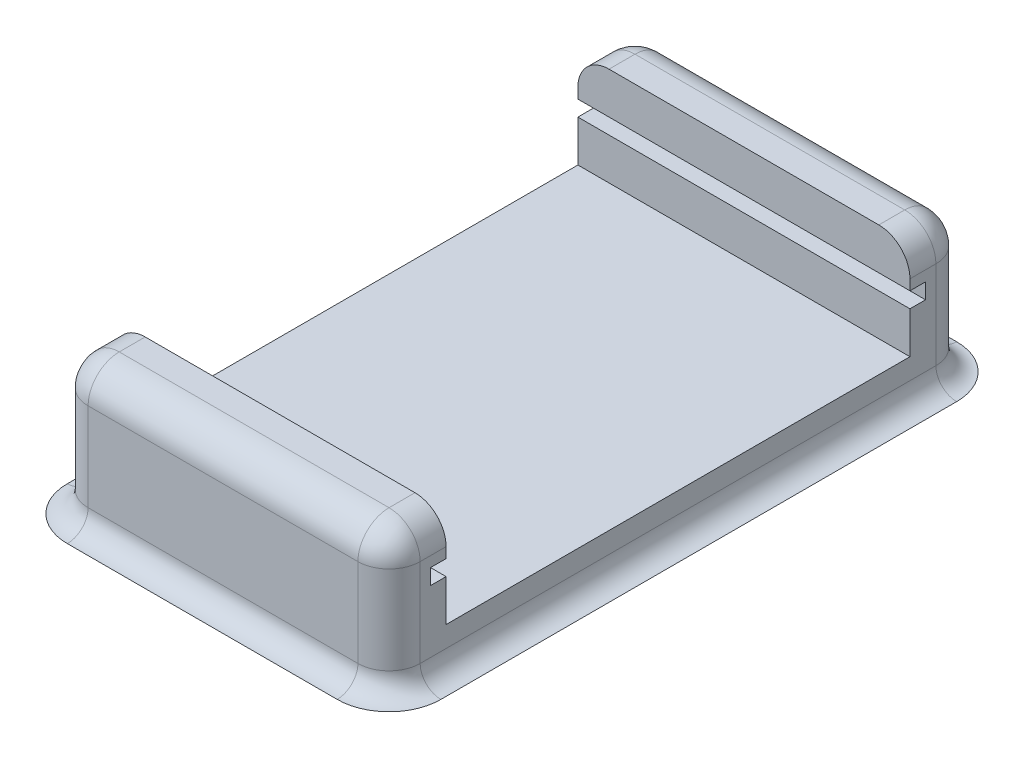
from build123d import *

# Parameters (mm, degrees)
SKETCH2_W               = 88.9
SKETCH2_H               = 152.4
BOSS_EXTRUDE1_DEPTH     = 5.9944
CUT_EXTRUDE2_DEPTH      = 177.535840076
CUT_EXTRUDE2_DEPTH_BACK = 177.535840076
SKETCH4_R               = 2.7305
BOSS_EXTRUDE2_DEPTH     = 101.6
FILLET1_R               = 3.81
FILLET2_R               = 2.54
BOSS_EXTRUDE3_DEPTH     = 20.32
FILLET3_R               = 3.81
FILLET6_R               = 3.81
FILLET7_R               = 2.54
CUT_EXTRUDE3_DEPTH      = 204.596488182
CUT_EXTRUDE3_DEPTH_BACK = 204.596488182
SKETCH7_W               = 2.54
SKETCH7_H               = 152.4
SKETCH8_W               = 86.36
SKETCH8_H               = 152.4
CUT_EXTRUDE4_DEPTH      = 5.9944
SKETCH9_R               = 0.79375
CUT_EXTRUDE5_DEPTH      = 3.175


with BuildPart() as part:
    # Sketch2 → Boss-Extrude1 (new body)
    with BuildSketch(Plane(origin=(0, 0, 0), x_dir=(1, 0, 0), z_dir=(0, 1, 0))):
        with Locations((44.45, 76.2)):
            Rectangle(SKETCH2_W, SKETCH2_H)
    extrude(amount=BOSS_EXTRUDE1_DEPTH)

    # Sketch4 → Cut-Extrude2 (cut, two sides: drawn at the far end of the back side and taken through both)
    with BuildSketch(Plane(origin=(0, 5.9944, 0), x_dir=(1, 0, 0), z_dir=(0, 1, 0)).offset(-CUT_EXTRUDE2_DEPTH_BACK)):
        with Locations(Location((45.72, 109.871331367, 0), (0, 0, 270))):
            Circle(SKETCH4_R)
        with Locations(Location((45.72, 33.671331367, 0), (0, 0, 270))):
            Circle(SKETCH4_R)
    extrude(amount=CUT_EXTRUDE2_DEPTH + CUT_EXTRUDE2_DEPTH_BACK, mode=Mode.SUBTRACT)

    # Sketch5 → Boss-Extrude2 (add)
    with BuildSketch(Plane(origin=(0, 5.9944, 0), x_dir=(1, 0, 0), z_dir=(0, 1, 0))):
        Polygon((18.542, 15.748), (12.446, 15.748), (12.446, 2.54), (76.454, 2.54), (76.454, 15.748), (70.358, 15.748), (70.358, 13.208), (71.374, 13.208), (71.374, 11.43), (70.358, 11.43), (70.358, 7.62), (18.542, 7.62), (18.542, 11.43), (17.526, 11.43), (17.526, 13.208), (18.542, 13.208), align=None)
    extrude(amount=BOSS_EXTRUDE2_DEPTH)

    # Fillet1
    fillet1_edges = [part.edges().sort_by_distance(p)[0] for p in [
        (12.446, 56.7944, -15.748),
        (12.446, 56.7944, -2.54),
        (76.454, 56.7944, -2.54),
        (76.454, 56.7944, -15.748),
    ]]
    fillet(fillet1_edges, radius=FILLET1_R)

    # Fillet2
    fillet2_edges = [part.edges().sort_by_distance(p)[0] for p in [
        (71.501, 5.9944, -15.748),
        (44.45, 5.9944, -2.54),
        (12.446, 5.9944, -9.144),
        (17.399, 5.9944, -15.748),
        (76.454, 5.9944, -9.144),
        (13.561923164, 5.9944, -3.655923164),
        (13.561923164, 5.9944, -14.632076836),
        (75.338076836, 5.9944, -3.655923164),
        (75.338076836, 5.9944, -14.632076836),
    ]]
    fillet(fillet2_edges, radius=FILLET2_R - 0.0001)  # a hair under: the kernel refuses the full size

    # Sketch6 → Boss-Extrude3 (add, symmetric)
    with BuildSketch(Plane.ZY.offset(-44.45)):
        Polygon((-149.86, 5.9944), (-79.121, 5.9944), (-79.121, 23.1394), (-86.106, 23.1394), (-86.106, 18.0594), (-84.201, 18.0594), (-84.201, 16.1544), (-86.106, 16.1544), (-86.106, 11.0744), (-142.875, 11.0744), (-142.875, 16.1544), (-144.78, 16.1544), (-144.78, 18.0594), (-142.875, 18.0594), (-142.875, 23.1394), (-149.86, 23.1394), align=None)
    extrude(amount=BOSS_EXTRUDE3_DEPTH, both=True)

    # Fillet3
    fillet3_edges = [part.edges().sort_by_distance(p)[0] for p in [
        (44.45, 23.1394, -149.86),
        (44.45, 23.1394, -79.121),
    ]]
    fillet(fillet3_edges, radius=FILLET3_R)

    # Fillet6
    fillet6_edges = [part.edges().sort_by_distance(p)[0] for p in [
        (24.13, 12.6619, -149.86),
        (64.77, 12.6619, -79.121),
        (24.13, 23.1394, -84.5185),
        (24.13, 12.6619, -79.121),
        (64.77, 23.1394, -84.5185),
        (64.77, 12.6619, -149.86),
        (64.77, 23.1394, -144.4625),
        (64.77, 22.023476836, -148.744076836),
        (64.77, 22.023476836, -80.236923164),
        (24.13, 23.1394, -144.4625),
        (24.13, 22.023476836, -148.744076836),
        (24.13, 22.023476836, -80.236923164),
    ]]
    fillet(fillet6_edges, radius=FILLET6_R)

    # Fillet7
    fillet7_edges = [part.edges().sort_by_distance(p)[0] for p in [
        (24.13, 5.9944, -114.4905),
        (64.77, 5.9944, -114.4905),
        (44.45, 5.9944, -79.121),
        (44.45, 5.9944, -149.86),
        (25.245923164, 5.9944, -80.236923164),
        (63.654076836, 5.9944, -80.236923164),
        (63.654076836, 5.9944, -148.744076836),
        (25.245923164, 5.9944, -148.744076836),
    ]]
    fillet(fillet7_edges, radius=FILLET7_R - 0.0001)  # a hair under: the kernel refuses the full size

    # Sketch7 → Cut-Extrude3 (cut, two sides: drawn at the far end of the back side and taken through both)
    with BuildSketch(Plane(origin=(0, 5.9944, 0), x_dir=(1, 0, 0), z_dir=(0, 1, 0)).offset(-CUT_EXTRUDE3_DEPTH_BACK)):
        with Locations((1.27, 76.2)):
            Rectangle(SKETCH7_W, SKETCH7_H)
    extrude(amount=CUT_EXTRUDE3_DEPTH + CUT_EXTRUDE3_DEPTH_BACK, mode=Mode.SUBTRACT)

    # Sketch8 → Cut-Extrude4 (cut)
    with BuildSketch(Plane.XZ):
        with Locations((45.72, -76.2)):
            Rectangle(SKETCH8_W, SKETCH8_H)
    extrude(amount=-CUT_EXTRUDE4_DEPTH, mode=Mode.SUBTRACT)


with BuildPart() as body_2:
    # of the pieces the cut leaves, the one that is kept (cut_extrude4_keep)
    add(part.part.solids().sort_by_distance((27.94, 8.5343, -149.86))[0])

    # Sketch9 → Cut-Extrude5 (cut)
    with BuildSketch(Plane.XZ.offset(-5.9944)):
        with Locations(Location((44.45, -89.0905, 0), (0, 0, 270))):
            Circle(SKETCH9_R)
        with Locations(Location((44.45, -139.8905, 0), (0, 0, 270))):
            Circle(SKETCH9_R)
    extrude(amount=-CUT_EXTRUDE5_DEPTH, mode=Mode.SUBTRACT)


solid = body_2.part
